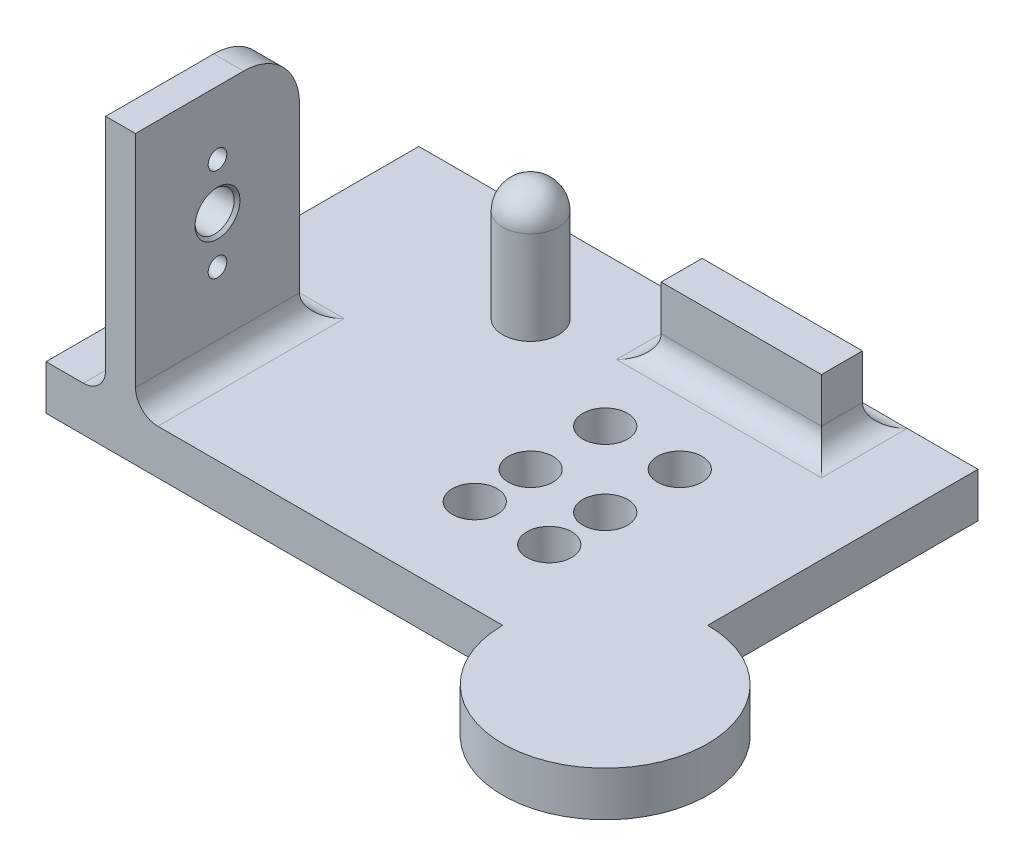
from build123d import *
from build123d.topology import SkipClean

# Parameters (mm, degrees)
SKETCH1_W                        = 150
SKETCH1_H                        = 100
BOSS_EXTRUDE1_DEPTH              = 12
SKETCH2_W                        = 8
SKETCH2_H                        = 44
BOSS_EXTRUDE2_DEPTH              = 65
FILLET1_R                        = 6
CUT_EXTRUDE1_DEPTH               = 179.339563754
F_5_0_5_DIAMETER_HOLE1_D         = 5
M12X1_5_TAPPED_HOLE1_D           = 10.5
M12X1_5_TAPPED_HOLE1_CSINK_D     = 12.05
M12X1_5_TAPPED_HOLE1_CSINK_ANGLE = 90
SKETCH8_R                        = 7.5
BOSS_EXTRUDE3_DEPTH              = 25
BOSS_EXTRUDE4_DEPTH              = 12
CUT_EXTRUDE2_DEPTH               = 214.848661441
CUT_EXTRUDE2_DEPTH_BACK          = 214.848661441
SKETCH10_R                       = 6
REVOLVE1_ANGLE                   = 180
SKETCH12_W                       = 43
SKETCH12_H                       = 11
BOSS_EXTRUDE5_DEPTH              = 18
FILLET2_R                        = 6


with BuildPart() as part:
    # Sketch1 → Boss-Extrude1 (new body)
    with BuildSketch(Plane(origin=(0, 0, 0), x_dir=(1, 0, 0), z_dir=(0, 1, 0))):
        with Locations((75, 50)):
            Rectangle(SKETCH1_W, SKETCH1_H)
    extrude(amount=BOSS_EXTRUDE1_DEPTH)

    # Sketch2 → Boss-Extrude2 (add)
    with BuildSketch(Plane(origin=(0, 12, 0), x_dir=(1, 0, 0), z_dir=(0, 1, 0))):
        with Locations((20, 22)):
            Rectangle(SKETCH2_W, SKETCH2_H)
    extrude(amount=BOSS_EXTRUDE2_DEPTH)

    # Fillet1
    fillet1_edges = [part.edges().sort_by_distance(p)[0] for p in [
        (16, 12, -22),
        (24, 12, -22),
        (20, 12, -44),
    ]]
    fillet(fillet1_edges, radius=FILLET1_R)

    # Sketch3 → Cut-Extrude1 (cut, through all)
    with BuildSketch(Plane(origin=(24, 0, 0), x_dir=(0, 0, -1), z_dir=(1, 0, 0))):
        with BuildLine():
            Line((44, 77), (29, 77))
            ThreePointArc((29, 77), (39.606601718, 72.606601718), (44, 62))
            Line((44, 62), (44, 77))
        make_face()
    extrude(amount=-CUT_EXTRUDE1_DEPTH, mode=Mode.SUBTRACT)

    # Ø5.0 (5) Diameter Hole1 (through all)
    with Locations(Plane(origin=(24, 0, 0), x_dir=(0, 0, -1), z_dir=(1, 0, 0))):
        with Locations((22, 60), (22, 35)):
            Hole(F_5_0_5_DIAMETER_HOLE1_D / 2)

    # M12x1.5 Tapped Hole1 (through all)
    with Locations(Plane(origin=(24, 0, 0), x_dir=(0, 0, -1), z_dir=(1, 0, 0))):
        with Locations((22, 47.5)):
            CounterSinkHole(M12X1_5_TAPPED_HOLE1_D / 2, M12X1_5_TAPPED_HOLE1_CSINK_D / 2, counter_sink_angle=M12X1_5_TAPPED_HOLE1_CSINK_ANGLE)

    # Sketch8 → Boss-Extrude3 (add)
    with BuildSketch(Plane(origin=(0, 12, 0), x_dir=(1, 0, 0), z_dir=(0, 1, 0))):
        with Locations(Location((55, 75, 0), (0, 0, 90))):
            Circle(SKETCH8_R)
    extrude(amount=BOSS_EXTRUDE3_DEPTH)

    # Sketch9 → Boss-Extrude4 (add)
    with BuildSketch(Plane(origin=(0, 12, 0), x_dir=(1, 0, 0), z_dir=(0, 1, 0))):
        with BuildLine():
            ThreePointArc((177.5, 0), (169.445436483, 19.445436483), (150, 27.5))
            Line((150, 27.5), (150, 0))
            Line((150, 0), (122.5, 0))
            ThreePointArc((122.5, 0), (150, -27.5), (177.5, 0))
        make_face()
        with BuildLine():
            Line((150, 0), (150, 27.5))
            ThreePointArc((150, 27.5), (130.554563517, 19.445436483), (122.5, 0))
            Line((122.5, 0), (150, 0))
        make_face()
    extrude(amount=-BOSS_EXTRUDE4_DEPTH)

    # Sketch10 → Cut-Extrude2 (cut, two sides: drawn at the far end of the back side and taken through both)
    with BuildSketch(Plane(origin=(0, 12, 0), x_dir=(1, 0, 0), z_dir=(0, 1, 0)).offset(-CUT_EXTRUDE2_DEPTH_BACK)):
        with Locations(Location((90, 60, 0), (0, 0, 270))):
            Circle(SKETCH10_R)
        with Locations(Location((110, 60, 0), (0, 0, 270))):
            Circle(SKETCH10_R)
        with Locations(Location((90, 40, 0), (0, 0, 270))):
            Circle(SKETCH10_R)
        with Locations(Location((110, 40, 0), (0, 0, 270))):
            Circle(SKETCH10_R)
        with Locations(Location((90, 25, 0), (0, 0, 270))):
            Circle(SKETCH10_R)
        with Locations(Location((110, 25, 0), (0, 0, 270))):
            Circle(SKETCH10_R)
    extrude(amount=CUT_EXTRUDE2_DEPTH + CUT_EXTRUDE2_DEPTH_BACK, mode=Mode.SUBTRACT)

    # Sketch11 → Revolve1 (revolve)
    with SkipClean():  # the faces are left unmerged after this step: merging them gives an invalid solid
        with BuildSketch(Plane(origin=(0, 37, 0), x_dir=(1, 0, 0), z_dir=(0, 1, 0))):
            with BuildLine():
                ThreePointArc((62.5, 75), (60.303300859, 80.303300859), (55, 82.5))
                Line((55, 82.5), (55, 67.5))
                ThreePointArc((55, 67.5), (60.303300859, 69.696699141), (62.5, 75))
            make_face()
            with BuildLine():
                Line((55, 67.5), (55, 82.5))
                ThreePointArc((55, 82.5), (47.5, 75), (55, 67.5))
            make_face()
        revolve(axis=Axis((55, 37, -82.5), (0, 0, 1)), revolution_arc=REVOLVE1_ANGLE)

    # Sketch12 → Boss-Extrude5 (add)
    with BuildSketch(Plane(origin=(0, 12, 0), x_dir=(1, 0, 0), z_dir=(0, 1, 0))):
        with Locations((103.5, 88.5)):
            Rectangle(SKETCH12_W, SKETCH12_H)
    extrude(amount=BOSS_EXTRUDE5_DEPTH)

    # Fillet2
    fillet2_edges = [part.edges().sort_by_distance(p)[0] for p in [
        (82, 12, -88.5),
        (103.5, 12, -83),
        (125, 12, -88.5),
        (103.5, 12, -94),
    ]]
    fillet(fillet2_edges, radius=FILLET2_R - 0.0001)  # a hair under: the kernel refuses the full size


solid = part.part
